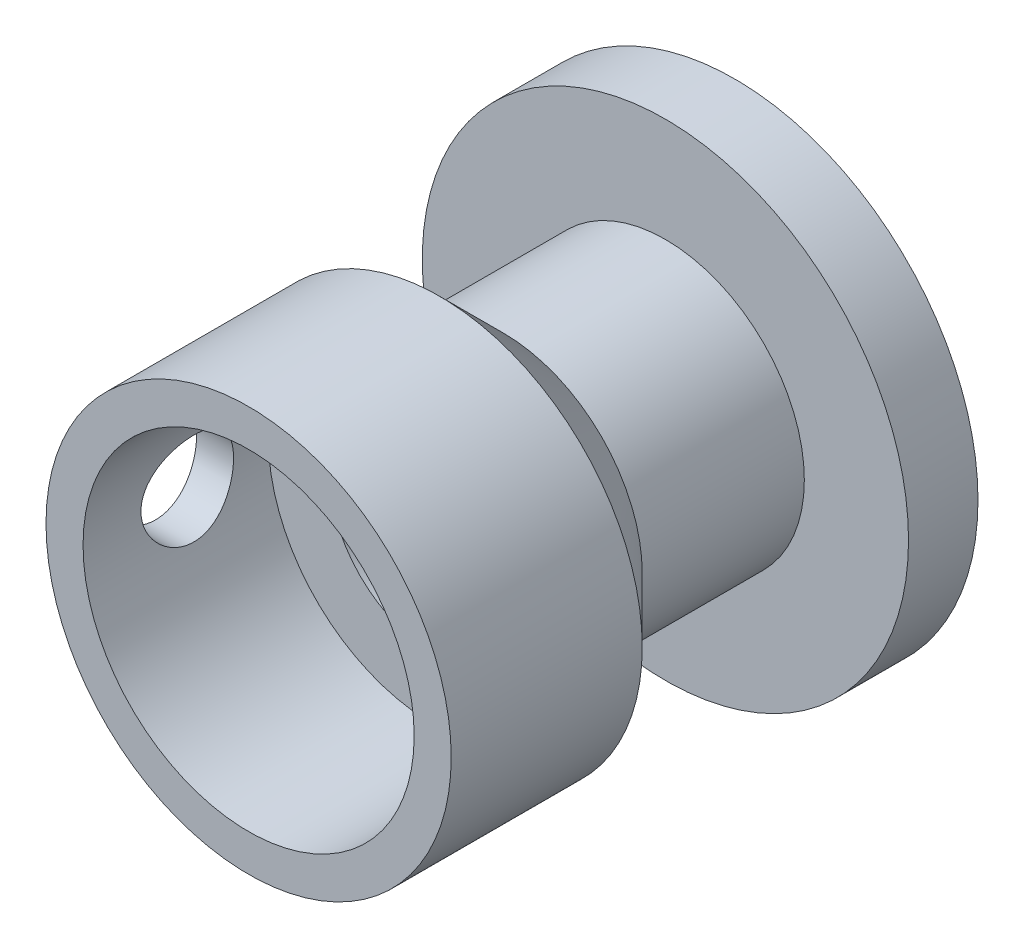
from build123d import *

# Parameters (mm, degrees)
SKETCH1_R               = 10.5
BOSS_EXTRUDE2_DEPTH     = 3
SKETCH2_R               = 6
BOSS_EXTRUDE3_DEPTH     = 10
SKETCH3_R               = 4.5
CUT_EXTRUDE1_DEPTH      = 4
SKETCH4_R               = 8.75
BOSS_EXTRUDE4_DEPTH     = 8
CHAMFER1_SIZE           = 3
SKETCH5_R               = 7.15
CUT_EXTRUDE3_DEPTH      = 8
SKETCH6_R               = 1.5
CUT_EXTRUDE4_DEPTH      = 9
CUT_EXTRUDE5_REACH      = 27.72
CUT_EXTRUDE5_END_RADIUS = 8.75
SKETCH7_R               = 2


with BuildPart() as part:
    # Sketch1 → Boss-Extrude2 (new body)
    with BuildSketch(Plane.XY):
        Circle(SKETCH1_R)
    extrude(amount=BOSS_EXTRUDE2_DEPTH)

    # Sketch2 → Boss-Extrude3 (add)
    with BuildSketch(Plane.XY.offset(3)):
        Circle(SKETCH2_R)
    extrude(amount=BOSS_EXTRUDE3_DEPTH)

    # Sketch3 → Cut-Extrude1 (cut)
    with BuildSketch(Plane.XY.offset(13)):
        Circle(SKETCH3_R)
    extrude(amount=-CUT_EXTRUDE1_DEPTH, mode=Mode.SUBTRACT)

    # Sketch4 → Boss-Extrude4 (add)
    with BuildSketch(Plane.XY.offset(13)):
        Circle(SKETCH4_R)
    extrude(amount=BOSS_EXTRUDE4_DEPTH)

    # Chamfer1
    # the kernel refuses this chamfer: 3 mm, written as the material it adds along each edge
    with BuildSketch(Plane(origin=(0, 0, 13), x_dir=(1, 0, 0), z_dir=(0, -1, 0))) as chamfer1_piece_1_section:
        Polygon((6 + CHAMFER1_SIZE, 0), (6, -CHAMFER1_SIZE), (6, 0), align=None)
    chamfer1_piece_1 = revolve(axis=Axis((0, 0, 13), (0, 0, 1)), mode=Mode.PRIVATE)
    chamfer1_piece_1 = chamfer1_piece_1 & Plane(origin=(0, 0, 11.374833607), x_dir=(1, 0, 0), z_dir=(0, 0, -1)) * Cylinder(8.75, 36, mode=Mode.PRIVATE)
    add(chamfer1_piece_1)

    # Sketch5 → Cut-Extrude3 (cut)
    with BuildSketch(Plane.XY.offset(21)):
        Circle(SKETCH5_R)
    extrude(amount=-CUT_EXTRUDE3_DEPTH, mode=Mode.SUBTRACT)

    # Sketch6 → Cut-Extrude4 (cut)
    with BuildSketch(Plane.XY.offset(9)):
        Circle(SKETCH6_R)
    extrude(amount=-CUT_EXTRUDE4_DEPTH, mode=Mode.SUBTRACT)

    # Cut-Extrude5: up to this cylinder (the profile starts inside it)
    cut_extrude5_end = Plane(origin=(0, 0, 16.5), z_dir=(0, 0, -1)) * Cylinder(CUT_EXTRUDE5_END_RADIUS, 73.94, mode=Mode.PRIVATE)
    # Sketch7 → Cut-Extrude5 (cut, up to the surface)
    with BuildSketch(Plane(origin=(0, 0, 0), x_dir=(0, 0, -1), z_dir=(1, 0, 0)), mode=Mode.PRIVATE) as cut_extrude5_sk1:
        with Locations((-16.5, 0)):
            Circle(SKETCH7_R)
    cut_extrude5_tool1 = extrude(cut_extrude5_sk1.sketch, amount=-CUT_EXTRUDE5_REACH, mode=Mode.PRIVATE) & cut_extrude5_end
    add(cut_extrude5_tool1.solids().sort_by_distance((0, 0, 16.5))[0], mode=Mode.SUBTRACT)


solid = part.part
